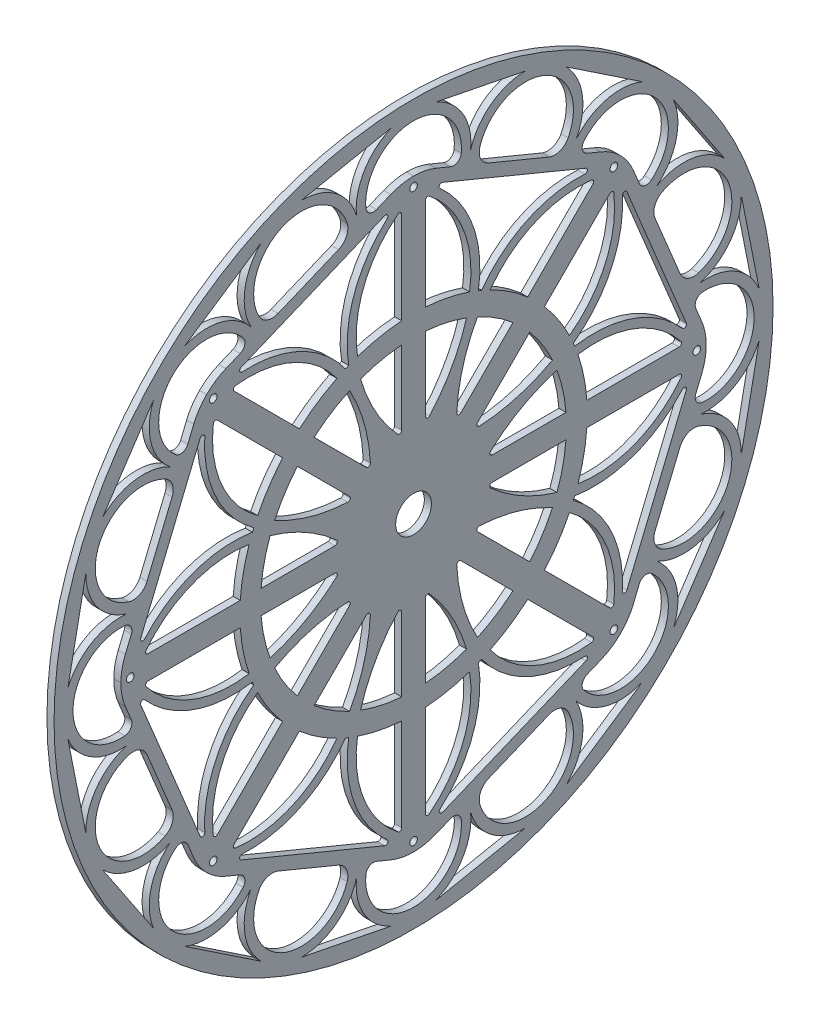
from build123d import *

# Parameters (mm, degrees)
BOSS_EXTRUDE3_DEPTH   = 3
CUT_EXTRUDE5_DEPTH    = 3
CUT_EXTRUDE6_DEPTH    = 3
FILLET3_R             = 1
FILLET4_R             = 25
CIRPATTERN2_OUTLINE_R = 1.5
CIRPATTERN2_DEPTH     = 3
BOSS_EXTRUDE5_DEPTH   = 3
SKETCH8_R             = 1.6
CUT_EXTRUDE7_DEPTH    = 196.787035797
CIRPATTERN4_COUNT     = 8
SKETCH9_R             = 73.34932166
SKETCH9_R_2           = 64.570140835
BOSS_EXTRUDE6_DEPTH   = 3
SKETCH10_R            = 7.55
CUT_EXTRUDE8_DEPTH    = 10


# Read off the part's stored shape, not the designer's step: CirPattern2
with BuildPart() as part:
    # Sketch1 → Boss-Extrude3 (new body)
    with BuildSketch(Plane.YZ):
        with BuildLine():
            Line((0, 0), (-83.523510552, 83.523510552))
            ThreePointArc((-83.523510552, 83.523510552), (-85.644830895, 83.523510552), (-85.644830895, 85.644830895))
            Line((-85.644830895, 85.644830895), (-87.391798613, 87.391798613))
            Line((-87.391798613, 87.391798613), (-90.927332519, 83.856264707))
            Line((-90.927332519, 83.856264707), (-123.590666839, 5))
            Line((-123.590666839, 5), (-123.590666839, 0))
            Line((-123.590666839, 0), (-121.120081399, 0))
            ThreePointArc((-121.120081399, 0), (-119.620081399, 1.5), (-118.120081399, 0))
            Line((-118.120081399, 0), (0, 0))
        make_face()
    extrude(amount=BOSS_EXTRUDE3_DEPTH)

    # Sketch2 → Cut-Extrude5 (cut)
    with BuildSketch(Plane.YZ.offset(3)):
        with BuildLine():
            ThreePointArc((-64.22969944, 26.604812615), (-94.665294208, 24.445038601), (-118.178705837, 5))
            Line((-118.178705837, 5), (-87.100498195, 80.029430384))
            ThreePointArc((-87.100498195, 80.029430384), (-84.223724039, 49.653218916), (-64.22969944, 26.604812615))
        make_face()
        with BuildLine():
            ThreePointArc((-62.69896571, 30.300330745), (-80.685060609, 50.439062402), (-84.272071071, 77.201003259))
            Line((-84.272071071, 77.201003259), (-55.280693042, 48.20962523))
            Line((-55.280693042, 48.20962523), (-62.69896571, 30.300330745))
        make_face()
        with BuildLine():
            Line((-65.760433169, 22.909294485), (-73.178705837, 5))
            Line((-73.178705837, 5), (-114.178705837, 5))
            ThreePointArc((-114.178705837, 5), (-92.718756558, 21.387150435), (-65.760433169, 22.909294485))
        make_face()
    extrude(amount=-CUT_EXTRUDE5_DEPTH, mode=Mode.SUBTRACT)

    # Sketch4 → Cut-Extrude6 (cut)
    with BuildSketch(Plane.YZ.offset(3)):
        with BuildLine():
            Line((-51.453858718, 44.382790907), (-25.22623001, 18.155162198))
            ThreePointArc((-25.22623001, 18.155162198), (-42.482972176, 20.525989151), (-58.653593196, 27.001094285))
            Line((-58.653593196, 27.001094285), (-51.453858718, 44.382790907))
        make_face()
        with BuildLine():
            Line((-67.766744836, 5), (-30.675276607, 5))
            ThreePointArc((-30.675276607, 5), (-44.554063831, 15.525931591), (-60.567010358, 22.381696622))
            Line((-60.567010358, 22.381696622), (-67.766744836, 5))
        make_face()
    extrude(amount=-CUT_EXTRUDE6_DEPTH, mode=Mode.SUBTRACT)

    # Fillet3
    fillet3_edges = [part.edges().sort_by_distance(p)[0] for p in [
        (1.5, -114.178705837, 5),
        (1.5, -84.272071071, 77.201003259),
        (1.5, -118.178705837, 5),
        (1.5, -87.100498195, 80.029430384),
        (1.5, -30.675276607, 5),
        (1.5, -25.22623001, 18.155162198),
    ]]
    fillet(fillet3_edges, radius=FILLET3_R)

    # Fillet4
    fillet4_edges = [part.edges().sort_by_distance(p)[0] for p in [
        (1.5, -123.590666839, 5),
        (1.5, -90.927332519, 83.856264707),
    ]]
    fillet(fillet4_edges, radius=FILLET4_R)

    # CirPattern2 outline → CirPattern2 (add)
    with BuildSketch(Plane.YZ):
        with BuildLine():
            ThreePointArc((-85.644830895, 85.644830895), (-83.523510551, 85.644830895), (-83.523510551, 83.523510551))
            Line((-83.523510551, 83.523510551), (0, 0))
            Line((0, 0), (-118.120081399, 0))
            ThreePointArc((-118.120081399, 0), (-119.620081399, -1.5), (-121.120081399, 0))
            Line((-121.120081399, 0), (-123.590666839, 0))
            Line((-123.590666839, 0), (-123.590666839, -0.027190816))
            ThreePointArc((-123.590666839, -0.027190816), (-123.110298849, -4.904448866), (-121.687655152, -9.594276625))
            Line((-121.687655152, -9.594276625), (-92.830344206, -79.261988083))
            ThreePointArc((-92.830344206, -79.261988083), (-90.520096201, -83.584158099), (-87.411025423, -87.372571803))
            Line((-87.411025423, -87.372571803), (-87.372571803, -87.411025423))
            ThreePointArc((-87.372571803, -87.411025423), (-83.584158099, -90.520096201), (-79.261988083, -92.830344206))
            Line((-79.261988083, -92.830344206), (-9.594276625, -121.687655152))
            ThreePointArc((-9.594276625, -121.687655152), (-4.904448866, -123.110298849), (-0.027190816, -123.590666839))
            Line((-0.027190816, -123.590666839), (0.027190816, -123.590666839))
            ThreePointArc((0.027190816, -123.590666839), (4.904448866, -123.110298849), (9.594276625, -121.687655152))
            Line((9.594276625, -121.687655152), (79.261988083, -92.830344206))
            ThreePointArc((79.261988083, -92.830344206), (83.584158099, -90.520096201), (87.372571803, -87.411025423))
            Line((87.372571803, -87.411025423), (87.411025423, -87.372571803))
            ThreePointArc((87.411025423, -87.372571803), (90.520096201, -83.584158099), (92.830344206, -79.261988083))
            Line((92.830344206, -79.261988083), (121.687655152, -9.594276625))
            ThreePointArc((121.687655152, -9.594276625), (123.110298849, -4.904448866), (123.590666839, -0.027190816))
            Line((123.590666839, -0.027190816), (123.590666839, 0.027190816))
            ThreePointArc((123.590666839, 0.027190816), (123.110298849, 4.904448866), (121.687655152, 9.594276625))
            Line((121.687655152, 9.594276625), (92.830344206, 79.261988083))
            ThreePointArc((92.830344206, 79.261988083), (90.520096201, 83.584158099), (87.411025423, 87.372571803))
            Line((87.411025423, 87.372571803), (87.372571803, 87.411025423))
            ThreePointArc((87.372571803, 87.411025423), (83.584158099, 90.520096201), (79.261988083, 92.830344206))
            Line((79.261988083, 92.830344206), (9.594276625, 121.687655152))
            ThreePointArc((9.594276625, 121.687655152), (4.904448866, 123.110298849), (0.027190816, 123.590666839))
            Line((0.027190816, 123.590666839), (-0.027190816, 123.590666839))
            ThreePointArc((-0.027190816, 123.590666839), (-4.904448866, 123.110298849), (-9.594276625, 121.687655152))
            Line((-9.594276625, 121.687655152), (-79.261988083, 92.830344206))
            ThreePointArc((-79.261988083, 92.830344206), (-83.584158099, 90.520096201), (-87.372571803, 87.411025423))
            Line((-87.372571803, 87.411025423), (-87.391798613, 87.391798613))
            Line((-87.391798613, 87.391798613), (-85.644830895, 85.644830895))
        make_face()
        with Locations((-84.584170723, -84.584170723)):
            Circle(CIRPATTERN2_OUTLINE_R, mode=Mode.SUBTRACT)
        with BuildLine():
            ThreePointArc((-72.373701908, -88.165856998), (-46.159210034, -82.565239769), (-26.604812615, -64.22969944))
            ThreePointArc((-26.604812615, -64.22969944), (-25.742950503, -91.02193136), (-11.166739954, -113.518610751))
            ThreePointArc((-11.166739954, -113.518610751), (-10.981502806, -114.797440795), (-12.212184442, -115.191321227))
            Line((-12.212184442, -115.191321227), (-72.817245942, -90.087882806))
            ThreePointArc((-72.817245942, -90.087882806), (-73.408953748, -88.939143951), (-72.373701908, -88.165856998))
        make_face(mode=Mode.SUBTRACT)
        with BuildLine():
            Line((-75.78838816, -82.859455972), (-48.20962523, -55.280693042))
            Line((-48.20962523, -55.280693042), (-30.300330745, -62.69896571))
            ThreePointArc((-30.300330745, -62.69896571), (-49.526195584, -80.252961286), (-75.201713523, -84.559284315))
            ThreePointArc((-75.201713523, -84.559284315), (-76.026564017, -83.892815314), (-75.78838816, -82.859455972))
        make_face(mode=Mode.SUBTRACT)
        with BuildLine():
            ThreePointArc((-6.616801763, -112.96808494), (-21.727104392, -91.767721879), (-22.909294485, -65.760433169))
            Line((-22.909294485, -65.760433169), (-5, -73.178705837))
            Line((-5, -73.178705837), (-5, -112.180966406))
            ThreePointArc((-5, -112.180966406), (-5.562279634, -113.080077568), (-6.616801763, -112.96808494))
        make_face(mode=Mode.SUBTRACT)
        with BuildLine():
            ThreePointArc((-84.559284315, -75.201713523), (-80.252961286, -49.526195584), (-62.69896571, -30.300330745))
            Line((-62.69896571, -30.300330745), (-55.280693042, -48.20962523))
            Line((-55.280693042, -48.20962523), (-82.859455972, -75.78838816))
            ThreePointArc((-82.859455972, -75.78838816), (-83.892815314, -76.026564017), (-84.559284315, -75.201713523))
        make_face(mode=Mode.SUBTRACT)
        with BuildLine():
            ThreePointArc((-113.518610751, -11.166739954), (-91.02193136, -25.742950503), (-64.22969944, -26.604812615))
            ThreePointArc((-64.22969944, -26.604812615), (-82.56523977, -46.159210033), (-88.165856998, -72.373701908))
            ThreePointArc((-88.165856998, -72.373701908), (-88.939143951, -73.408953748), (-90.087882806, -72.817245942))
            Line((-90.087882806, -72.817245942), (-115.191321227, -12.212184442))
            ThreePointArc((-115.191321227, -12.212184442), (-114.797440795, -10.981502806), (-113.518610751, -11.166739954))
        make_face(mode=Mode.SUBTRACT)
        with BuildLine():
            ThreePointArc((-65.760433169, -22.909294485), (-91.767721879, -21.727104392), (-112.96808494, -6.616801763))
            ThreePointArc((-112.96808494, -6.616801763), (-113.080077568, -5.562279634), (-112.180966406, -5))
            Line((-112.180966406, -5), (-73.178705837, -5))
            Line((-73.178705837, -5), (-65.760433169, -22.909294485))
        make_face(mode=Mode.SUBTRACT)
        with BuildLine():
            Line((-27.001094285, -58.653593196), (-44.382790907, -51.453858718))
            Line((-44.382790907, -51.453858718), (-19.942927948, -27.01399576))
            ThreePointArc((-19.942927948, -27.01399576), (-18.830167575, -26.807075647), (-18.237070378, -27.771071133))
            ThreePointArc((-18.237070378, -27.771071133), (-20.862637732, -43.710786353), (-27.001094285, -58.653593196))
        make_face(mode=Mode.SUBTRACT)
        with BuildLine():
            Line((-27.01399576, -19.942927948), (-51.453858718, -44.382790907))
            Line((-51.453858718, -44.382790907), (-58.653593196, -27.001094285))
            ThreePointArc((-58.653593196, -27.001094285), (-43.710786353, -20.862637732), (-27.771071133, -18.237070378))
            ThreePointArc((-27.771071133, -18.237070378), (-26.807075647, -18.830167575), (-27.01399576, -19.942927948))
        make_face(mode=Mode.SUBTRACT)
        with BuildLine():
            Line((-5, -33.203559178), (-5, -67.766744836))
            Line((-5, -67.766744836), (-22.381696622, -60.567010358))
            ThreePointArc((-22.381696622, -60.567010358), (-16.156080828, -45.660306054), (-6.741556586, -32.532668852))
            ThreePointArc((-6.741556586, -32.532668852), (-5.640525791, -32.270404157), (-5, -33.203559178))
        make_face(mode=Mode.SUBTRACT)
        with BuildLine():
            Line((-60.567010358, -22.381696622), (-67.766744836, -5))
            Line((-67.766744836, -5), (-33.203559178, -5))
            ThreePointArc((-33.203559178, -5), (-32.270404157, -5.640525791), (-32.532668852, -6.741556586))
            ThreePointArc((-32.532668852, -6.741556586), (-45.660306054, -16.156080828), (-60.567010358, -22.381696622))
        make_face(mode=Mode.SUBTRACT)
        with Locations((0, -119.620081399)):
            Circle(CIRPATTERN2_OUTLINE_R, mode=Mode.SUBTRACT)
        with BuildLine():
            ThreePointArc((22.909294485, -65.760433169), (21.727104392, -91.767721879), (6.616801763, -112.96808494))
            ThreePointArc((6.616801763, -112.96808494), (5.562279634, -113.080077568), (5, -112.180966406))
            Line((5, -112.180966406), (5, -73.178705837))
            Line((5, -73.178705837), (22.909294485, -65.760433169))
        make_face(mode=Mode.SUBTRACT)
        with BuildLine():
            ThreePointArc((11.166739954, -113.518610751), (25.742950503, -91.02193136), (26.604812615, -64.22969944))
            ThreePointArc((26.604812615, -64.22969944), (46.159210033, -82.56523977), (72.373701908, -88.165856998))
            ThreePointArc((72.373701908, -88.165856998), (73.408953748, -88.939143951), (72.817245942, -90.087882806))
            Line((72.817245942, -90.087882806), (12.212184442, -115.191321227))
            ThreePointArc((12.212184442, -115.191321227), (10.981502806, -114.797440795), (11.166739954, -113.518610751))
        make_face(mode=Mode.SUBTRACT)
        with BuildLine():
            Line((30.300330745, -62.69896571), (48.20962523, -55.280693042))
            Line((48.20962523, -55.280693042), (75.78838816, -82.859455972))
            ThreePointArc((75.78838816, -82.859455972), (76.026564017, -83.892815314), (75.201713523, -84.559284315))
            ThreePointArc((75.201713523, -84.559284315), (49.526195584, -80.252961286), (30.300330745, -62.69896571))
        make_face(mode=Mode.SUBTRACT)
        with Locations((84.584170723, -84.584170723)):
            Circle(CIRPATTERN2_OUTLINE_R, mode=Mode.SUBTRACT)
        with BuildLine():
            Line((22.381696622, -60.567010358), (5, -67.766744836))
            Line((5, -67.766744836), (5, -33.203559178))
            ThreePointArc((5, -33.203559178), (5.640525791, -32.270404157), (6.741556586, -32.532668852))
            ThreePointArc((6.741556586, -32.532668852), (16.156080828, -45.660306054), (22.381696622, -60.567010358))
        make_face(mode=Mode.SUBTRACT)
        with BuildLine():
            Line((19.942927948, -27.01399576), (44.382790907, -51.453858718))
            Line((44.382790907, -51.453858718), (27.001094285, -58.653593196))
            ThreePointArc((27.001094285, -58.653593196), (20.862637732, -43.710786353), (18.237070378, -27.771071133))
            ThreePointArc((18.237070378, -27.771071133), (18.830167575, -26.807075647), (19.942927948, -27.01399576))
        make_face(mode=Mode.SUBTRACT)
        with BuildLine():
            Line((58.653593196, -27.001094285), (51.453858718, -44.382790907))
            Line((51.453858718, -44.382790907), (27.01399576, -19.942927948))
            ThreePointArc((27.01399576, -19.942927948), (26.807075647, -18.830167575), (27.771071133, -18.237070378))
            ThreePointArc((27.771071133, -18.237070378), (43.710786353, -20.862637732), (58.653593196, -27.001094285))
        make_face(mode=Mode.SUBTRACT)
        with BuildLine():
            Line((33.203559178, -5), (67.766744836, -5))
            Line((67.766744836, -5), (60.567010358, -22.381696622))
            ThreePointArc((60.567010358, -22.381696622), (45.660306054, -16.156080828), (32.532668852, -6.741556586))
            ThreePointArc((32.532668852, -6.741556586), (32.270404157, -5.640525791), (33.203559178, -5))
        make_face(mode=Mode.SUBTRACT)
        with BuildLine():
            Line((82.859455972, -75.78838816), (55.280693042, -48.20962523))
            Line((55.280693042, -48.20962523), (62.69896571, -30.300330745))
            ThreePointArc((62.69896571, -30.300330745), (80.252961286, -49.526195584), (84.559284315, -75.201713523))
            ThreePointArc((84.559284315, -75.201713523), (83.892815314, -76.026564017), (82.859455972, -75.78838816))
        make_face(mode=Mode.SUBTRACT)
        with BuildLine():
            ThreePointArc((88.165856998, -72.373701908), (82.565239769, -46.159210034), (64.22969944, -26.604812615))
            ThreePointArc((64.22969944, -26.604812615), (91.02193136, -25.742950503), (113.518610751, -11.166739954))
            ThreePointArc((113.518610751, -11.166739954), (114.797440795, -10.981502806), (115.191321227, -12.212184442))
            Line((115.191321227, -12.212184442), (90.087882806, -72.817245942))
            ThreePointArc((90.087882806, -72.817245942), (88.939143951, -73.408953748), (88.165856998, -72.373701908))
        make_face(mode=Mode.SUBTRACT)
        with BuildLine():
            Line((65.760433169, -22.909294485), (73.178705837, -5))
            Line((73.178705837, -5), (112.180966406, -5))
            ThreePointArc((112.180966406, -5), (113.080077568, -5.562279634), (112.96808494, -6.616801763))
            ThreePointArc((112.96808494, -6.616801763), (91.767721879, -21.727104392), (65.760433169, -22.909294485))
        make_face(mode=Mode.SUBTRACT)
        with BuildLine():
            Line((-19.942927948, 27.01399576), (-44.382790907, 51.453858718))
            Line((-44.382790907, 51.453858718), (-27.001094285, 58.653593196))
            ThreePointArc((-27.001094285, 58.653593196), (-20.862637732, 43.710786353), (-18.237070378, 27.771071133))
            ThreePointArc((-18.237070378, 27.771071133), (-18.830167575, 26.807075647), (-19.942927948, 27.01399576))
        make_face(mode=Mode.SUBTRACT)
        with BuildLine():
            Line((-22.381696622, 60.567010358), (-5, 67.766744836))
            Line((-5, 67.766744836), (-5, 33.203559178))
            ThreePointArc((-5, 33.203559178), (-5.640525791, 32.270404157), (-6.741556586, 32.532668852))
            ThreePointArc((-6.741556586, 32.532668852), (-16.156080828, 45.660306054), (-22.381696622, 60.567010358))
        make_face(mode=Mode.SUBTRACT)
        with BuildLine():
            Line((-30.300330745, 62.69896571), (-48.20962523, 55.280693042))
            Line((-48.20962523, 55.280693042), (-75.78838816, 82.859455972))
            ThreePointArc((-75.78838816, 82.859455972), (-76.026564017, 83.892815314), (-75.201713523, 84.559284315))
            ThreePointArc((-75.201713523, 84.559284315), (-49.526195584, 80.252961286), (-30.300330745, 62.69896571))
        make_face(mode=Mode.SUBTRACT)
        with BuildLine():
            ThreePointArc((-11.166739954, 113.518610751), (-25.742950503, 91.02193136), (-26.604812615, 64.22969944))
            ThreePointArc((-26.604812615, 64.22969944), (-46.159210034, 82.565239769), (-72.373701908, 88.165856998))
            ThreePointArc((-72.373701908, 88.165856998), (-73.408953748, 88.939143951), (-72.817245942, 90.087882806))
            Line((-72.817245942, 90.087882806), (-12.212184442, 115.191321227))
            ThreePointArc((-12.212184442, 115.191321227), (-10.981502806, 114.797440795), (-11.166739954, 113.518610751))
        make_face(mode=Mode.SUBTRACT)
        with BuildLine():
            ThreePointArc((-6.616801763, 112.96808494), (-5.562279634, 113.080077568), (-5, 112.180966406))
            Line((-5, 112.180966406), (-5, 73.178705837))
            Line((-5, 73.178705837), (-22.909294485, 65.760433169))
            ThreePointArc((-22.909294485, 65.760433169), (-21.727104392, 91.767721879), (-6.616801763, 112.96808494))
        make_face(mode=Mode.SUBTRACT)
        with BuildLine():
            Line((60.567010358, 22.381696622), (67.766744836, 5))
            Line((67.766744836, 5), (33.203559178, 5))
            ThreePointArc((33.203559178, 5), (32.270404157, 5.640525791), (32.532668852, 6.741556586))
            ThreePointArc((32.532668852, 6.741556586), (45.660306054, 16.156080828), (60.567010358, 22.381696622))
        make_face(mode=Mode.SUBTRACT)
        with BuildLine():
            Line((5, 33.203559178), (5, 67.766744836))
            Line((5, 67.766744836), (22.381696622, 60.567010358))
            ThreePointArc((22.381696622, 60.567010358), (16.156080828, 45.660306054), (6.741556586, 32.532668852))
            ThreePointArc((6.741556586, 32.532668852), (5.640525791, 32.270404157), (5, 33.203559178))
        make_face(mode=Mode.SUBTRACT)
        with BuildLine():
            Line((27.01399576, 19.942927948), (51.453858718, 44.382790907))
            Line((51.453858718, 44.382790907), (58.653593196, 27.001094285))
            ThreePointArc((58.653593196, 27.001094285), (43.710786353, 20.862637732), (27.771071133, 18.237070378))
            ThreePointArc((27.771071133, 18.237070378), (26.807075647, 18.830167575), (27.01399576, 19.942927948))
        make_face(mode=Mode.SUBTRACT)
        with BuildLine():
            Line((27.001094285, 58.653593196), (44.382790907, 51.453858718))
            Line((44.382790907, 51.453858718), (19.942927948, 27.01399576))
            ThreePointArc((19.942927948, 27.01399576), (18.830167575, 26.807075647), (18.237070378, 27.771071133))
            ThreePointArc((18.237070378, 27.771071133), (20.862637732, 43.710786353), (27.001094285, 58.653593196))
        make_face(mode=Mode.SUBTRACT)
        with BuildLine():
            ThreePointArc((112.96808494, 6.616801763), (113.080077568, 5.562279634), (112.180966406, 5))
            Line((112.180966406, 5), (73.178705837, 5))
            Line((73.178705837, 5), (65.760433169, 22.909294485))
            ThreePointArc((65.760433169, 22.909294485), (91.767721879, 21.727104392), (112.96808494, 6.616801763))
        make_face(mode=Mode.SUBTRACT)
        with Locations((119.620081399, 0)):
            Circle(CIRPATTERN2_OUTLINE_R, mode=Mode.SUBTRACT)
        with BuildLine():
            ThreePointArc((113.518610751, 11.166739954), (91.02193136, 25.742950503), (64.22969944, 26.604812615))
            ThreePointArc((64.22969944, 26.604812615), (82.56523977, 46.159210033), (88.165856998, 72.373701908))
            ThreePointArc((88.165856998, 72.373701908), (88.939143951, 73.408953748), (90.087882806, 72.817245942))
            Line((90.087882806, 72.817245942), (115.191321227, 12.212184442))
            ThreePointArc((115.191321227, 12.212184442), (114.797440795, 10.981502806), (113.518610751, 11.166739954))
        make_face(mode=Mode.SUBTRACT)
        with BuildLine():
            Line((62.69896571, 30.300330745), (55.280693042, 48.20962523))
            Line((55.280693042, 48.20962523), (82.859455972, 75.78838816))
            ThreePointArc((82.859455972, 75.78838816), (83.892815314, 76.026564017), (84.559284315, 75.201713523))
            ThreePointArc((84.559284315, 75.201713523), (80.252961286, 49.526195584), (62.69896571, 30.300330745))
        make_face(mode=Mode.SUBTRACT)
        with BuildLine():
            Line((22.909294485, 65.760433169), (5, 73.178705837))
            Line((5, 73.178705837), (5, 112.180966406))
            ThreePointArc((5, 112.180966406), (5.562279634, 113.080077568), (6.616801763, 112.96808494))
            ThreePointArc((6.616801763, 112.96808494), (21.727104392, 91.767721879), (22.909294485, 65.760433169))
        make_face(mode=Mode.SUBTRACT)
        with BuildLine():
            ThreePointArc((75.201713523, 84.559284315), (76.026564017, 83.892815314), (75.78838816, 82.859455972))
            Line((75.78838816, 82.859455972), (48.20962523, 55.280693042))
            Line((48.20962523, 55.280693042), (30.300330745, 62.69896571))
            ThreePointArc((30.300330745, 62.69896571), (49.526195584, 80.252961286), (75.201713523, 84.559284315))
        make_face(mode=Mode.SUBTRACT)
        with BuildLine():
            ThreePointArc((72.373701908, 88.165856998), (46.159210034, 82.565239769), (26.604812615, 64.22969944))
            ThreePointArc((26.604812615, 64.22969944), (25.742950503, 91.02193136), (11.166739954, 113.518610751))
            ThreePointArc((11.166739954, 113.518610751), (10.981502806, 114.797440795), (12.212184442, 115.191321227))
            Line((12.212184442, 115.191321227), (72.817245942, 90.087882806))
            ThreePointArc((72.817245942, 90.087882806), (73.408953748, 88.939143951), (72.373701908, 88.165856998))
        make_face(mode=Mode.SUBTRACT)
        with Locations((0, 119.620081399)):
            Circle(CIRPATTERN2_OUTLINE_R, mode=Mode.SUBTRACT)
        with Locations((84.584170723, 84.584170723)):
            Circle(CIRPATTERN2_OUTLINE_R, mode=Mode.SUBTRACT)
    extrude(amount=CIRPATTERN2_DEPTH)

    # Sketch7 → Boss-Extrude5 (add)
    with BuildSketch(Plane.YZ.offset(3)):
        with BuildLine():
            Line((-147.818676244, 0), (-143.818676244, 0))
            ThreePointArc((-143.818676244, 0), (-137.296284825, 14.877109938), (-121.935316821, 20.160163214))
            ThreePointArc((-121.935316821, 20.160163214), (-119.410563337, 18.604158284), (-119.180378235, 15.647378563))
            Line((-119.180378235, 15.647378563), (-112.548471147, 31.658218597))
            ThreePointArc((-112.548471147, 31.658218597), (-115.751608494, 28.321107938), (-120.36850322, 28.037066564))
            ThreePointArc((-120.36850322, 28.037066564), (-132.871131375, 55.037024663), (-104.93858476, 65.288184976))
            ThreePointArc((-104.93858476, 65.288184976), (-101.874794773, 61.822699826), (-101.969528211, 57.19804611))
            Line((-101.969528211, 57.19804611), (-95.337621123, 73.208886145))
            ThreePointArc((-95.337621123, 73.208886145), (-97.591145561, 71.2808926), (-100.476677509, 71.965901272))
            ThreePointArc((-100.476677509, 71.965901272), (-107.602839353, 86.56342871), (-101.695161233, 101.695161233))
            Line((-101.695161233, 101.695161233), (-104.523588358, 104.523588358))
            Line((-104.523588358, 104.523588358), (-107.352015483, 107.352015483))
            ThreePointArc((-107.352015483, 107.352015483), (-140.262167635, 58.098492122), (-151.818676244, 0))
            Line((-151.818676244, 0), (-147.818676244, 0))
        make_face()
        with BuildLine():
            Line((-109.775560986, 96.663455519), (-131.31467441, 64.427892854))
            ThreePointArc((-131.31467441, 64.427892854), (-117.737874784, 71.261876917), (-102.761887244, 68.663295864))
            ThreePointArc((-102.761887244, 68.663295864), (-110.893725164, 81.504873426), (-109.775560986, 96.663455519))
        make_face(mode=Mode.SUBTRACT)
        with BuildLine():
            Line((-138.410896679, 47.296102897), (-145.974430877, 9.271652886))
            ThreePointArc((-145.974430877, 9.271652886), (-136.046356448, 20.78105474), (-121.215909442, 24.111345194))
            ThreePointArc((-121.215909442, 24.111345194), (-133.643007883, 32.863495699), (-138.410896679, 47.296102897))
        make_face(mode=Mode.SUBTRACT)
    boss_extrude5 = extrude(amount=-BOSS_EXTRUDE5_DEPTH)

    # Sketch8 → Cut-Extrude7 (cut, symmetric)
    with BuildSketch(Plane(origin=(3, 0, 0), x_dir=(0, 0, -1), z_dir=(1, 0, 0))):
        with Locations((-84.584170723, -84.584170723)):
            Circle(SKETCH8_R)
    cut_extrude7 = extrude(amount=CUT_EXTRUDE7_DEPTH, both=True, mode=Mode.SUBTRACT)

    # CirPattern4: Boss-Extrude5, Cut-Extrude7 ×8 about axis
    cirpattern4_axis = Axis((0, 0, 0), (1, 0, 0))
    add([boss_extrude5.rotate(cirpattern4_axis, i * 360 / CIRPATTERN4_COUNT) for i in range(1, CIRPATTERN4_COUNT)])
    add([cut_extrude7.rotate(cirpattern4_axis, i * 360 / CIRPATTERN4_COUNT) for i in range(1, CIRPATTERN4_COUNT)], mode=Mode.SUBTRACT)

    # Sketch9 → Boss-Extrude6 (add)
    with BuildSketch(Plane.ZY):
        Circle(SKETCH9_R)
        Circle(SKETCH9_R_2, mode=Mode.SUBTRACT)
    extrude(amount=-BOSS_EXTRUDE6_DEPTH)

    # Sketch10 → Cut-Extrude8 (cut)
    with BuildSketch(Plane.ZY):
        Circle(SKETCH10_R)
    extrude(amount=-CUT_EXTRUDE8_DEPTH, mode=Mode.SUBTRACT)


solid = part.part
